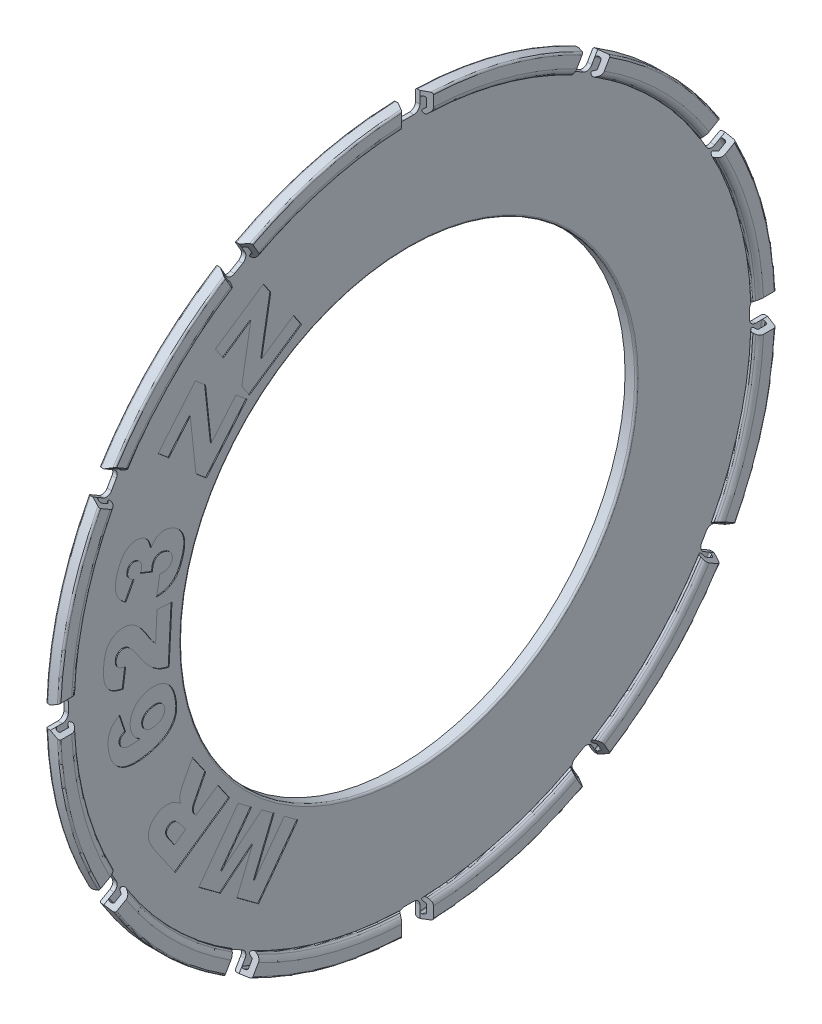
from build123d import *
from OCP.BRepFilletAPI import BRepFilletAPI_MakeFillet

# Parameters (mm, degrees)
FILLET1_R1         = 0.02
FILLET1_R2         = 0.08
SKETCH3_W          = 0.249361734
SKETCH3_H          = 0.345695775
CUT_EXTRUDE2_DEPTH = 6.799732894
CUT_EXTRUDE2_TAPER = -30
CUT_EXTRUDE3_REACH = 7.8
CIRPATTERN2_COUNT  = 12
CUT_EXTRUDE1_DEPTH = 0.01


with BuildPart() as part:
    # Sketch1 → Revolve1 (revolve)
    with BuildSketch(Plane.XY):
        Polygon((1.02, -2.65), (1.1, -2.65), (1.1, -4.1), (1.248703916, -4.1), (1.248703916, -3.92), (1.187420361, -3.868576991), (1.15528098, -3.906879213), (1.198703916, -3.943315383), (1.198703916, -4.05), (1.15, -4.05), (1.15, -2.6), (1.02, -2.6), align=None)
    revolve(axis=Axis((-6.429017492, 0, 0), (1, 0, 0)))

    # Fillet1: one fillet with a radius per group of edges: ONE call of the kernel's fillet builder (fillet() takes one radius for all edges)
    fillet1_edges_1 = [part.edges().sort_by_distance(p)[0] for p in [
        (1.187420361, 3.868576991, 0),
        (1.15528098, 3.906879213, 0),
        (1.15, 2.6, 0),
        (1.248703916, 4.1, 0),
        (1.1, 4.1, 0),
        (1.15, 4.05, 0),
        (1.198703916, 4.05, 0),
    ]]
    fillet1_edges_2 = [part.edges().sort_by_distance(p)[0] for p in [
        (1.248703916, 3.92, 0),
    ]]
    fillet1 = BRepFilletAPI_MakeFillet(part.part.solid().wrapped)
    for e in fillet1_edges_1:
        fillet1.Add(FILLET1_R1, e.wrapped)
    for e in fillet1_edges_2:
        fillet1.Add(FILLET1_R2, e.wrapped)
    add(Compound.cast(fillet1.Shape()), mode=Mode.REPLACE)

    # Sketch3 → Cut-Extrude2 (cut, through all)
    with BuildSketch(Plane(origin=(1.15, 0, 0), x_dir=(0, 0, -1), z_dir=(1, 0, 0))):
        with Locations((0, 3.957248854)):
            Rectangle(SKETCH3_W, SKETCH3_H)
    cut_extrude2 = extrude(amount=CUT_EXTRUDE2_DEPTH, taper=CUT_EXTRUDE2_TAPER, mode=Mode.SUBTRACT)

    # Cut-Extrude3: up to this face of the body (flat: up to its plane)
    cut_extrude3_end = Plane(part.part.faces().sort_by_distance((1.1, 3.964600173, 0))[0])
    # Sketch4 → Cut-Extrude3 (cut, up to the picked face)
    with BuildSketch(Plane(origin=(1.15, 0, 0), x_dir=(0, 0, -1), z_dir=(1, 0, 0)), mode=Mode.PRIVATE) as cut_extrude3_sk1:
        with BuildLine():
            Line((-0.124680867, 4.098103791), (-0.124680867, 3.96268108))
            ThreePointArc((-0.124680867, 3.96268108), (-0.104178342, 3.913183605), (-0.054680867, 3.89268108))
            Line((-0.054680867, 3.89268108), (0.054680867, 3.89268108))
            ThreePointArc((0.054680867, 3.89268108), (0.104178342, 3.913183605), (0.124680867, 3.96268108))
            Line((0.124680867, 3.96268108), (0.124680867, 4.098103791))
            ThreePointArc((0.124680867, 4.098103791), (0, 4.1), (-0.124680867, 4.098103791))
        make_face()
    cut_extrude3_tool1 = split(extrude(cut_extrude3_sk1.sketch, amount=-CUT_EXTRUDE3_REACH, mode=Mode.PRIVATE), bisect_by=cut_extrude3_end, keep=Keep.BOTH, mode=Mode.PRIVATE)
    cut_extrude3 = cut_extrude3_tool1.solids().sort_by(Axis((1.15, 3.999757, 0), (-1, 0, 0)))[0]
    add(cut_extrude3, mode=Mode.SUBTRACT)

    # CirPattern2: Cut-Extrude2, Cut-Extrude3 ×12 about axis
    cirpattern2_axis = Axis((0, 0, 0), (1, 0, 0))
    add([cut_extrude2.rotate(cirpattern2_axis, i * 360 / CIRPATTERN2_COUNT) for i in range(1, CIRPATTERN2_COUNT)], mode=Mode.SUBTRACT)
    add([cut_extrude3.rotate(cirpattern2_axis, i * 360 / CIRPATTERN2_COUNT) for i in range(1, CIRPATTERN2_COUNT)], mode=Mode.SUBTRACT)

    # Sketch2 → Cut-Extrude1 (cut)
    # profile 1 of 7: a face of its own
    with BuildSketch(Plane(origin=(1.15, 0, 0), x_dir=(0, 0, -1), z_dir=(1, 0, 0))):
        Polygon((-2.212074833, 2.706157821), (-1.663424265, 3.076135499), (-1.57895795, 2.950729655), (-1.682904784, 2.346376977), (-1.31825381, 2.592318535), (-1.22739545, 2.457476814), (-1.822768826, 2.055995483), (-1.910583356, 2.186119266), (-1.807701862, 2.784079899), (-2.121825239, 2.572229249), align=None)
    # profile 2 of 7: a face of its own
    with BuildSketch(Plane(origin=(1.15, 0, 0), x_dir=(0, 0, -1), z_dir=(1, 0, 0))):
        Polygon((-2.866893351, 1.999189565), (-2.440756987, 2.505226496), (-2.325091403, 2.407823899), (-2.259649033, 1.798144516), (-1.976420542, 2.13448786), (-1.852080039, 2.029780068), (-2.314590185, 1.480672925), (-2.434669325, 1.581880311), (-2.499502929, 2.185015457), (-2.743465997, 1.89524273), align=None)
    # profile 3 of 7: a face of its own
    with BuildSketch(Plane(origin=(1.15, 0, 0), x_dir=(0, 0, -1), z_dir=(1, 0, 0))):
        with BuildLine():
            Line((-3.141397188, 0.890050122), (-3.234994996, 0.712290381))
            add(Edge.make_bspline(
                [(-3.234994996, 0.712290381), (-3.241652025, 0.716717018), (-3.254716815, 0.72540454), (-3.272940512, 0.739733467), (-3.289267173, 0.755137837), (-3.30379652, 0.771514362), (-3.316687436, 0.788790714), (-3.327785169, 0.807039293), (-3.337140333, 0.826251788), (-3.344830176, 0.846382003), (-3.35047259, 0.867753095), (-3.354119764, 0.890280058), (-3.355562981, 0.914076921), (-3.355057782, 0.939058583), (-3.352589821, 0.965358989), (-3.347977427, 0.992862404), (-3.341211907, 1.021605488), (-3.335394145, 1.040951868), (-3.332397593, 1.050916599)],
                knots=[0, 0, 0, 0, 0.996965878, 1.956601256, 2.88770829, 3.793173997, 4.684173077, 5.573012264, 6.45318163, 7.346402628, 8.25663212, 9.205419306, 10.188307953, 11.226283579, 12.319409183, 13.480414381, 14.702238262, 16, 16, 16, 16], degree=3))
            add(Edge.make_bspline(
                [(-3.332397593, 1.050916599), (-3.328675336, 1.062176722), (-3.321480778, 1.083940828), (-3.308895369, 1.114677512), (-3.295848569, 1.142701673), (-3.281461002, 1.167473761), (-3.266605518, 1.189563268), (-3.250552217, 1.208460808), (-3.233834011, 1.224700397), (-3.215990926, 1.237706128), (-3.197629089, 1.247986463), (-3.179187478, 1.256354815), (-3.160432751, 1.262318172), (-3.141460028, 1.266199054), (-3.122239136, 1.267729801), (-3.102852561, 1.266870021), (-3.083215593, 1.264078942), (-3.070339067, 1.26038676), (-3.063779493, 1.258505885)],
                knots=[0, 0, 0, 0, 1.486482005, 2.873143656, 4.16197067, 5.358788456, 6.461443456, 7.494932611, 8.462177862, 9.376883809, 10.254180828, 11.09697377, 11.911647764, 12.716227884, 13.52017922, 14.322241245, 15.145314161, 16, 16, 16, 16], degree=3))
            add(Edge.make_bspline(
                [(-3.063779493, 1.258505885), (-3.05627325, 1.255786904), (-3.041489309, 1.25043173), (-3.021159139, 1.238562115), (-3.002838189, 1.224060775), (-2.986931475, 1.206418047), (-2.973065732, 1.186063316), (-2.961590577, 1.162779945), (-2.952222287, 1.136674978), (-2.948014303, 1.118088437), (-2.945831035, 1.108445008)],
                knots=[0, 0, 0, 0, 0.951343852, 1.873721842, 2.795821485, 3.730286132, 4.69776014, 5.726874251, 6.820612936, 8, 8, 8, 8], degree=3))
            add(Edge.make_bspline(
                [(-2.945831035, 1.108445008), (-2.942066207, 1.114493909), (-2.934964492, 1.125904141), (-2.923542305, 1.141107076), (-2.912985264, 1.154144046), (-2.905277386, 1.161181261), (-2.901695483, 1.164451501)],
                knots=[0, 0, 0, 0, 1.193944278, 2.252174855, 3.187773934, 4, 4, 4, 4], degree=3))
            add(Edge.make_bspline(
                [(-2.901695483, 1.164451501), (-2.896016699, 1.168960545), (-2.884778888, 1.177883543), (-2.866219024, 1.188611368), (-2.846507989, 1.196530549), (-2.825832536, 1.202100475), (-2.8040212, 1.204879141), (-2.781249093, 1.204467835), (-2.757514572, 1.201111708), (-2.741798329, 1.196608404), (-2.733676003, 1.194281047)],
                knots=[0, 0, 0, 0, 0.972616807, 1.924722696, 2.865728001, 3.81734653, 4.792250057, 5.807182763, 6.866728094, 8, 8, 8, 8], degree=3))
            add(Edge.make_bspline(
                [(-2.733676003, 1.194281047), (-2.723405031, 1.19061102), (-2.702896462, 1.183282892), (-2.67424629, 1.167070072), (-2.647600099, 1.147128777), (-2.627326004, 1.127542297), (-2.612408075, 1.110339787), (-2.602292888, 1.09653717), (-2.593376442, 1.082090984), (-2.585363251, 1.067079644), (-2.578510688, 1.05141923), (-2.5728841, 1.035013445), (-2.568324391, 1.018036173), (-2.564945276, 1.00038764), (-2.562846997, 0.981975525), (-2.561862729, 0.962701691), (-2.562622397, 0.942521542), (-2.564420967, 0.921431427), (-2.567641424, 0.899431172), (-2.572266756, 0.876535574), (-2.578184953, 0.85276001), (-2.583083654, 0.83676179), (-2.585593616, 0.828564732)],
                knots=[0, 0, 0, 0, 1.468544657, 2.93231749, 4.418159492, 5.947000875, 6.72313198, 7.486618499, 8.251635851, 9.01057301, 9.779495404, 10.553996804, 11.347185151, 12.148152775, 12.974626404, 13.8443874, 14.747798274, 15.695402368, 16.697679072, 17.744132734, 18.844154151, 20, 20, 20, 20], degree=3))
            add(Edge.make_bspline(
                [(-2.585593616, 0.828564732), (-2.588176667, 0.820631812), (-2.593204973, 0.80518916), (-2.601455124, 0.782965659), (-2.609890597, 0.762261113), (-2.618852313, 0.743130154), (-2.627789962, 0.725318468), (-2.637477837, 0.709217365), (-2.647160583, 0.694500321), (-2.660472911, 0.677170892), (-2.678401335, 0.658069034), (-2.701752935, 0.638203945), (-2.727186872, 0.621922415), (-2.75449044, 0.608912505), (-2.783826529, 0.59908208), (-2.815273453, 0.592770731), (-2.848777556, 0.588711328), (-2.871853383, 0.588811461), (-2.883736879, 0.588863027)],
                knots=[0, 0, 0, 0, 0.957077744, 1.863099244, 2.719135602, 3.521173556, 4.286468441, 5.004158756, 5.675688924, 6.306645927, 7.509093788, 8.673877084, 9.815319901, 10.963391327, 12.135813007, 13.354935907, 14.637855525, 16, 16, 16, 16], degree=3))
            Line((-2.883736879, 0.588863027), (-2.846906522, 0.796604505))
            add(Edge.make_bspline(
                [(-2.846906522, 0.796604505), (-2.84173485, 0.796116766), (-2.831758425, 0.795175892), (-2.817291302, 0.794318742), (-2.803867737, 0.794469213), (-2.791479013, 0.795426964), (-2.780043887, 0.79680153), (-2.769659634, 0.799272541), (-2.760296903, 0.802418464), (-2.749308866, 0.807738941), (-2.737185159, 0.816209466), (-2.724837753, 0.828957383), (-2.715099371, 0.844505375), (-2.71079128, 0.856169694), (-2.708564395, 0.862199066)],
                knots=[0, 0, 0, 0, 1.106073005, 2.133672459, 3.084299769, 3.961649642, 4.778960599, 5.53354789, 6.230416036, 6.877808649, 8.127330516, 9.357275926, 10.633956453, 12, 12, 12, 12], degree=3))
            add(Edge.make_bspline(
                [(-2.708564395, 0.862199066), (-2.706839977, 0.868747377), (-2.703468701, 0.881549469), (-2.70363803, 0.901346703), (-2.707818281, 0.920554317), (-2.716324791, 0.938806489), (-2.72853607, 0.955642955), (-2.74453588, 0.970206792), (-2.764255971, 0.981837995), (-2.778977061, 0.987232435), (-2.786638665, 0.990039975)],
                knots=[0, 0, 0, 0, 0.965377401, 1.887334252, 2.801512917, 3.75979478, 4.747193907, 5.759497664, 6.833928598, 8, 8, 8, 8], degree=3))
            add(Edge.make_bspline(
                [(-2.786638665, 0.990039975), (-2.790731478, 0.99126852), (-2.798646977, 0.993644524), (-2.81050287, 0.996108477), (-2.821908646, 0.997515346), (-2.832910506, 0.997786997), (-2.843467131, 0.997249201), (-2.853574645, 0.995564832), (-2.863234135, 0.992825446), (-2.875300833, 0.98775514), (-2.889215679, 0.97924007), (-2.903214877, 0.965236291), (-2.914556792, 0.947872788), (-2.91941207, 0.934562951), (-2.92193696, 0.927641437)],
                knots=[0, 0, 0, 0, 0.910977311, 1.761829841, 2.57907118, 3.358334845, 4.106094558, 4.829993581, 5.53886079, 6.242091453, 7.617117862, 8.986514487, 10.432897026, 12, 12, 12, 12], degree=3))
            add(Edge.make_bspline(
                [(-2.92193696, 0.927641437), (-2.923067095, 0.923293036), (-2.925529919, 0.913816872), (-2.928047247, 0.897987823), (-2.929577634, 0.879472098), (-2.930153434, 0.866209351), (-2.930459688, 0.859155235)],
                knots=[0, 0, 0, 0, 0.778957448, 1.697527352, 2.775373591, 4, 4, 4, 4], degree=3))
            Line((-2.930459688, 0.859155235), (-3.069867155, 0.914857346))
            add(Edge.make_bspline(
                [(-3.069867155, 0.914857346), (-3.067588218, 0.919585481), (-3.063613972, 0.927830894), (-3.060529501, 0.936446116), (-3.059213746, 0.940121144)],
                knots=[0, 0, 0, 0, 1.146852366, 2, 2, 2, 2], degree=3))
            add(Edge.make_bspline(
                [(-3.059213746, 0.940121144), (-3.057488932, 0.946467761), (-3.054121916, 0.958857017), (-3.053433036, 0.977878384), (-3.056333937, 0.99625753), (-3.062971575, 1.013482869), (-3.072239925, 1.029050803), (-3.08396119, 1.042183531), (-3.098169841, 1.052296388), (-3.1089674, 1.056324962), (-3.114459282, 1.058373985)],
                knots=[0, 0, 0, 0, 1.08461134, 2.117274327, 3.119891392, 4.141971817, 5.150467332, 6.100726669, 7.033986697, 8, 8, 8, 8], degree=3))
            add(Edge.make_bspline(
                [(-3.114459282, 1.058373985), (-3.119745281, 1.059848661), (-3.12988587, 1.06267766), (-3.145293758, 1.063477981), (-3.15978419, 1.061121702), (-3.173328131, 1.056004686), (-3.185295152, 1.047702639), (-3.195766217, 1.037026145), (-3.204053729, 1.023444716), (-3.207782149, 1.013201222), (-3.209731197, 1.007846388)],
                knots=[0, 0, 0, 0, 1.078489428, 2.068959391, 3.010225977, 3.952870467, 4.89514418, 5.856145084, 6.879289992, 8, 8, 8, 8], degree=3))
            add(Edge.make_bspline(
                [(-3.209731197, 1.007846388), (-3.211275304, 1.002153641), (-3.214259155, 0.991152905), (-3.214935751, 0.974388971), (-3.212741472, 0.958363596), (-3.206938511, 0.943012855), (-3.197096815, 0.928370056), (-3.182518323, 0.914860399), (-3.163823026, 0.90155429), (-3.149224101, 0.894065228), (-3.141397188, 0.890050122)],
                knots=[0, 0, 0, 0, 0.931616347, 1.800267452, 2.6365463, 3.478172771, 4.376201162, 5.404643436, 6.608553058, 8, 8, 8, 8], degree=3))
        make_face()
    # profile 4 of 7: a face of its own
    with BuildSketch(Plane(origin=(1.15, 0, 0), x_dir=(0, 0, -1), z_dir=(1, 0, 0))):
        with BuildLine():
            Line((-2.708015014, 0.451318248), (-2.74088839, -0.176471931))
            add(Edge.make_bspline(
                [(-2.74088839, -0.176471931), (-2.748572037, -0.175055613), (-2.763846211, -0.172240142), (-2.786375266, -0.166130244), (-2.808523188, -0.15893608), (-2.830235826, -0.150141865), (-2.851536635, -0.140191181), (-2.872283803, -0.128566516), (-2.892882866, -0.116095913), (-2.913092173, -0.10166559), (-2.933515243, -0.085095951), (-2.954474013, -0.065749172), (-2.976067704, -0.043250745), (-2.998412162, -0.017730441), (-3.021653279, 0.010661705), (-3.045565624, 0.042201611), (-3.070380175, 0.076643351), (-3.086643344, 0.101021529), (-3.095038147, 0.113605179)],
                knots=[0, 0, 0, 0, 0.793429032, 1.577242224, 2.369314293, 3.15790796, 3.95559384, 4.756022087, 5.572759965, 6.400737883, 7.276468852, 8.243030276, 9.296379999, 10.442997531, 11.68822691, 13.023092273, 14.463364906, 16, 16, 16, 16], degree=3))
            add(Edge.make_bspline(
                [(-3.095038147, 0.113605179), (-3.100138657, 0.121230345), (-3.109918298, 0.135850721), (-3.124342923, 0.156616675), (-3.138057591, 0.175103412), (-3.150645785, 0.191620908), (-3.162362744, 0.205941848), (-3.173127556, 0.218225002), (-3.183131792, 0.228248471), (-3.194859699, 0.238647252), (-3.208873113, 0.248750628), (-3.225586738, 0.257920208), (-3.242111011, 0.264091761), (-3.253272602, 0.265345549), (-3.258644072, 0.265948929)],
                knots=[0, 0, 0, 0, 1.430961346, 2.74370368, 3.943369243, 5.021209643, 5.98274246, 6.829149717, 7.567744642, 8.190069628, 9.272779028, 10.253558271, 11.159531995, 12, 12, 12, 12], degree=3))
            add(Edge.make_bspline(
                [(-3.258644072, 0.265948929), (-3.264197304, 0.265929377), (-3.275157005, 0.265890789), (-3.291099353, 0.261751401), (-3.305941623, 0.254424623), (-3.319135992, 0.243863735), (-3.330639044, 0.231090828), (-3.33910425, 0.215945862), (-3.344759222, 0.199047624), (-3.345980891, 0.18705654), (-3.346610793, 0.180873848)],
                knots=[0, 0, 0, 0, 0.975318568, 1.924860908, 2.872255198, 3.871807218, 4.885053729, 5.881764118, 6.907821917, 8, 8, 8, 8], degree=3))
            add(Edge.make_bspline(
                [(-3.346610793, 0.180873848), (-3.346651482, 0.174464181), (-3.346730155, 0.162070797), (-3.34282415, 0.144119191), (-3.335551895, 0.127959501), (-3.326976319, 0.115863971), (-3.318215593, 0.107344633), (-3.310348999, 0.101321201), (-3.301169733, 0.095810297), (-3.290912101, 0.090672455), (-3.279341455, 0.086084569), (-3.266537306, 0.082085076), (-3.252568629, 0.078173887), (-3.242730943, 0.076248805), (-3.237641637, 0.075252907)],
                knots=[0, 0, 0, 0, 1.361875955, 2.633249472, 3.87602828, 5.114291299, 5.763646398, 6.472382254, 7.219047427, 8.040367039, 8.913013902, 9.866199743, 10.896126464, 12, 12, 12, 12], degree=3))
            Line((-3.237641637, 0.075252907), (-3.265644884, -0.13340172))
            add(Edge.make_bspline(
                [(-3.265644884, -0.13340172), (-3.272761562, -0.131943187), (-3.286653459, -0.129096103), (-3.306689343, -0.123883056), (-3.325544571, -0.118258288), (-3.343151843, -0.112089854), (-3.35950984, -0.1052148), (-3.374629411, -0.097781806), (-3.388474798, -0.089690244), (-3.4053537, -0.078422311), (-3.424141717, -0.062030692), (-3.443778963, -0.039309812), (-3.459799071, -0.01305803), (-3.470985488, 0.010922544), (-3.477903156, 0.0320308), (-3.482573966, 0.04942467), (-3.485872104, 0.068288875), (-3.488755355, 0.088473711), (-3.490253942, 0.110085069), (-3.49121661, 0.133074658), (-3.491207599, 0.15744693), (-3.490494069, 0.174128546), (-3.490127433, 0.182700147)],
                knots=[0, 0, 0, 0, 0.997034666, 1.946231286, 2.840666683, 3.697414948, 4.505731738, 5.274948675, 6.008278083, 6.705507205, 8.058273482, 9.416316791, 10.811400837, 12.266591674, 13.037320093, 13.858197364, 14.736410977, 15.664112006, 16.655904539, 17.708236726, 18.822411473, 20, 20, 20, 20], degree=3))
            add(Edge.make_bspline(
                [(-3.490127433, 0.182700147), (-3.489587271, 0.191634285), (-3.488536162, 0.209019392), (-3.485866374, 0.23428408), (-3.482791294, 0.258015602), (-3.478771372, 0.280134581), (-3.474308868, 0.300687916), (-3.468982828, 0.319649175), (-3.462891862, 0.337017432), (-3.456178095, 0.353001779), (-3.44867817, 0.367772681), (-3.440228115, 0.381488589), (-3.431139547, 0.394449935), (-3.421216585, 0.406506289), (-3.410539876, 0.417656813), (-3.39903043, 0.427921986), (-3.386729999, 0.43735181), (-3.373620496, 0.445837936), (-3.360033876, 0.453451962), (-3.345954173, 0.459833456), (-3.33157377, 0.465207971), (-3.316877888, 0.469472842), (-3.301804303, 0.472509664), (-3.286450319, 0.474517147), (-3.270721879, 0.475274092), (-3.260165565, 0.474929576), (-3.254839283, 0.474755748)],
                knots=[0, 0, 0, 0, 1.517404861, 2.952746514, 4.306707147, 5.573838247, 6.763387418, 7.871665646, 8.910864369, 9.882203375, 10.809307837, 11.716567676, 12.611511199, 13.49148966, 14.36144762, 15.226501486, 16.103911768, 16.986660499, 17.872254385, 18.74216982, 19.604954155, 20.473379898, 21.333716735, 22.209650071, 23.096663112, 24, 24, 24, 24], degree=3))
            add(Edge.make_bspline(
                [(-3.254839283, 0.474755748), (-3.249148243, 0.474333172), (-3.237765937, 0.473488004), (-3.22092676, 0.470706339), (-3.204284641, 0.466720062), (-3.187952833, 0.461419874), (-3.171859955, 0.45478861), (-3.156034606, 0.447035674), (-3.140444687, 0.43803086), (-3.125067638, 0.427572143), (-3.109728457, 0.415341768), (-3.094009646, 0.401385698), (-3.078267179, 0.385117547), (-3.062061896, 0.367028492), (-3.045840551, 0.346621978), (-3.029070468, 0.324326427), (-3.012238998, 0.299772165), (-3.001191797, 0.282567432), (-2.995504868, 0.273710699)],
                knots=[0, 0, 0, 0, 0.800215034, 1.600461711, 2.390998423, 3.198929055, 4.006389423, 4.830702468, 5.669268767, 6.529861257, 7.436785155, 8.419605114, 9.476394529, 10.610505815, 11.825276582, 13.131860768, 14.523525948, 16, 16, 16, 16], degree=3))
            add(Edge.make_bspline(
                [(-2.995504868, 0.273710699), (-2.992266052, 0.268480482), (-2.986063045, 0.258463527), (-2.977022282, 0.244145385), (-2.96891367, 0.231088582), (-2.961358433, 0.219482801), (-2.954718393, 0.209147871), (-2.948783889, 0.200166918), (-2.943618491, 0.192550142), (-2.937597291, 0.183989034), (-2.929755044, 0.173856028), (-2.919602367, 0.161275923), (-2.90813421, 0.147721291), (-2.900040965, 0.138402899), (-2.895819397, 0.133542274)],
                knots=[0, 0, 0, 0, 1.285272736, 2.461565029, 3.537867242, 4.496295874, 5.354745273, 6.104353983, 6.745217981, 7.277492065, 8.290787016, 9.421352561, 10.654935392, 12, 12, 12, 12], degree=3))
            Line((-2.895819397, 0.133542274), (-2.878621751, 0.46029755))
            Line((-2.878621751, 0.46029755), (-2.708015014, 0.451318248))
        make_face()
    # profile 5 of 7: a face of its own
    with BuildSketch(Plane(origin=(1.15, 0, 0), x_dir=(0, 0, -1), z_dir=(1, 0, 0))):
        with BuildLine():
            Line((-3.305913474, -0.369455799), (-3.238796997, -0.568522357))
            add(Edge.make_bspline(
                [(-3.238796997, -0.568522357), (-3.245158881, -0.571267245), (-3.257085118, -0.576412919), (-3.272784073, -0.585815616), (-3.285149072, -0.596044088), (-3.294129854, -0.607200114), (-3.299873898, -0.619131335), (-3.303149461, -0.631577539), (-3.303961762, -0.644734426), (-3.302535772, -0.653509673), (-3.301804302, -0.658010994)],
                knots=[0, 0, 0, 0, 1.376229227, 2.579932909, 3.62451481, 4.550563211, 5.402963822, 6.237033689, 7.095674723, 8, 8, 8, 8], degree=3))
            add(Edge.make_bspline(
                [(-3.301804302, -0.658010994), (-3.300861106, -0.662055866), (-3.299013407, -0.669979673), (-3.294197879, -0.681073089), (-3.287848735, -0.691059872), (-3.280206866, -0.700117759), (-3.271117117, -0.708099367), (-3.260583748, -0.714974865), (-3.248663666, -0.720994043), (-3.239956949, -0.723917925), (-3.235448782, -0.725431854)],
                knots=[0, 0, 0, 0, 0.997858564, 1.954780912, 2.892909725, 3.836976372, 4.797008143, 5.792399625, 6.856947905, 8, 8, 8, 8], degree=3))
            add(Edge.make_bspline(
                [(-3.235448782, -0.725431854), (-3.231660809, -0.726430469), (-3.223364981, -0.728617481), (-3.209356978, -0.730188049), (-3.192957606, -0.731275858), (-3.174004935, -0.731345294), (-3.152540391, -0.730497149), (-3.128531202, -0.72899482), (-3.102041606, -0.726535187), (-3.083607172, -0.724311208), (-3.073973539, -0.723148981)],
                knots=[0, 0, 0, 0, 0.578532959, 1.267012559, 2.078796009, 3.008922317, 4.067196305, 5.25469, 6.565330996, 8, 8, 8, 8], degree=3))
            add(Edge.make_bspline(
                [(-3.073973539, -0.723148981), (-3.081166869, -0.718301075), (-3.095145518, -0.70888024), (-3.114074814, -0.693057801), (-3.130791115, -0.676658582), (-3.145190242, -0.659211429), (-3.157500677, -0.64041503), (-3.167208463, -0.619607941), (-3.175729431, -0.597152384), (-3.179286585, -0.581161614), (-3.181116396, -0.572935913)],
                knots=[0, 0, 0, 0, 1.094092579, 2.126127191, 3.108513383, 4.045476207, 4.976008096, 5.935278565, 6.937900982, 8, 8, 8, 8], degree=3))
            add(Edge.make_bspline(
                [(-3.181116396, -0.572935913), (-3.18262125, -0.564791868), (-3.18557718, -0.548794818), (-3.186768865, -0.524697552), (-3.185985057, -0.501138799), (-3.18252543, -0.478056125), (-3.177002918, -0.455389269), (-3.168578553, -0.433395427), (-3.158110148, -0.411820902), (-3.14512331, -0.391117323), (-3.130422608, -0.371411625), (-3.113693748, -0.353496578), (-3.095350834, -0.337489166), (-3.075487364, -0.323208479), (-3.053926355, -0.311030064), (-3.030759591, -0.300828071), (-3.006019058, -0.292358953), (-2.98873755, -0.288386346), (-2.979919156, -0.286359208)],
                knots=[0, 0, 0, 0, 1.015217046, 1.994153795, 2.953538227, 3.903444368, 4.853105709, 5.810468424, 6.787661882, 7.791304586, 8.804745155, 9.800168768, 10.792765989, 11.787780759, 12.796948867, 13.825306894, 14.890299314, 16, 16, 16, 16], degree=3))
            add(Edge.make_bspline(
                [(-2.979919156, -0.286359208), (-2.973895744, -0.285205508), (-2.961905284, -0.282908903), (-2.943836097, -0.281055777), (-2.925955023, -0.28005676), (-2.90825332, -0.28036094), (-2.890726623, -0.281942172), (-2.87336561, -0.284443963), (-2.856220703, -0.288378087), (-2.839238376, -0.293123221), (-2.822789991, -0.299213515), (-2.806961422, -0.306249301), (-2.791892595, -0.314313801), (-2.777544317, -0.323407089), (-2.764141221, -0.333748572), (-2.75127717, -0.344819769), (-2.73924124, -0.357054923), (-2.727949923, -0.370331293), (-2.717451299, -0.384690674), (-2.707594152, -0.400147895), (-2.698765706, -0.416935897), (-2.690267754, -0.434652693), (-2.683040516, -0.453760676), (-2.676360756, -0.473909679), (-2.670377509, -0.495284795), (-2.667143765, -0.510012608), (-2.665491396, -0.517538185)],
                knots=[0, 0, 0, 0, 1.000929695, 1.992493116, 2.962899351, 3.923891704, 4.880052671, 5.834777421, 6.78532487, 7.750164913, 8.711906634, 9.646292579, 10.576446766, 11.50016126, 12.416305573, 13.338124046, 14.269420861, 15.215482523, 16.181353131, 17.171774177, 18.205713531, 19.276585623, 20.377969038, 21.538354381, 22.742155216, 24, 24, 24, 24], degree=3))
            add(Edge.make_bspline(
                [(-2.665491396, -0.517538185), (-2.663781419, -0.526553985), (-2.660440072, -0.544171136), (-2.656996463, -0.570232613), (-2.654707569, -0.59516111), (-2.65431954, -0.619007379), (-2.655181539, -0.641675317), (-2.657408891, -0.66325413), (-2.661201774, -0.683721199), (-2.66654018, -0.703174617), (-2.673458012, -0.721744652), (-2.681907276, -0.739633771), (-2.691778694, -0.757052681), (-2.703452192, -0.773860305), (-2.716712298, -0.790061687), (-2.731360569, -0.805872325), (-2.74777625, -0.820928205), (-2.765699421, -0.835554674), (-2.785417917, -0.849487828), (-2.807046331, -0.862394616), (-2.830691922, -0.874277843), (-2.856205813, -0.885335655), (-2.883650775, -0.89550739), (-2.913002479, -0.904809037), (-2.944293482, -0.913159626), (-2.965947183, -0.917841371), (-2.977027516, -0.920237049)],
                knots=[0, 0, 0, 0, 1.129677814, 2.207425309, 3.235555562, 4.210169223, 5.141632426, 6.027340175, 6.878796051, 7.701658798, 8.508045382, 9.315592375, 10.135295873, 10.970442589, 11.831852822, 12.7113495, 13.621906363, 14.572093796, 15.558189464, 16.59193987, 17.670230266, 18.81440745, 20.014116808, 21.272492673, 22.604317472, 24, 24, 24, 24], degree=3))
            add(Edge.make_bspline(
                [(-2.977027516, -0.920237049), (-2.993225349, -0.923353002), (-3.024518553, -0.92937283), (-3.070463056, -0.934458095), (-3.113521916, -0.936566175), (-3.153864771, -0.935562202), (-3.191466931, -0.930817803), (-3.226363041, -0.923042323), (-3.258453827, -0.911797815), (-3.28763365, -0.897028833), (-3.314056059, -0.879265382), (-3.33798879, -0.85887286), (-3.359422064, -0.835885591), (-3.378415274, -0.810265617), (-3.394893139, -0.781986652), (-3.408671897, -0.751017833), (-3.420281649, -0.717544214), (-3.425564553, -0.693991301), (-3.428275487, -0.681905068)],
                knots=[0, 0, 0, 0, 1.358393524, 2.624331739, 3.804117078, 4.907931701, 5.944145187, 6.921470006, 7.848055704, 8.737704696, 9.608192535, 10.464928045, 11.322427703, 12.191710852, 13.086966777, 14.012873644, 14.980301475, 16, 16, 16, 16], degree=3))
            add(Edge.make_bspline(
                [(-3.428275487, -0.681905068), (-3.429697015, -0.674761595), (-3.432471369, -0.660819887), (-3.435657583, -0.640306478), (-3.437915952, -0.620806096), (-3.43952018, -0.602335538), (-3.440134415, -0.584862105), (-3.439877941, -0.568397049), (-3.438639727, -0.553004545), (-3.436086287, -0.534029127), (-3.430598637, -0.511687136), (-3.421595936, -0.4862622), (-3.409405393, -0.462640803), (-3.394492262, -0.440670621), (-3.376735084, -0.420239964), (-3.355752943, -0.401759484), (-3.332258618, -0.384288873), (-3.314860229, -0.374493079), (-3.305913474, -0.369455799)],
                knots=[0, 0, 0, 0, 0.954893233, 1.863637011, 2.720847669, 3.528416024, 4.293794443, 5.012273361, 5.686173113, 6.317359579, 7.520884693, 8.694934894, 9.846172531, 10.995506325, 12.169349251, 13.38458066, 14.655075761, 16, 16, 16, 16], degree=3))
        make_face()
        with BuildLine():
            add(Edge.make_bspline(
                [(-2.899105438, -0.68007877), (-2.894268508, -0.678979181), (-2.884814561, -0.676829997), (-2.871280405, -0.67255974), (-2.858738637, -0.667567996), (-2.847252797, -0.661724409), (-2.836653653, -0.655243963), (-2.827260848, -0.647724951), (-2.818715781, -0.639594715), (-2.811358824, -0.630640025), (-2.804976692, -0.621271425), (-2.799730336, -0.61157549), (-2.795651882, -0.60166952), (-2.792478206, -0.591617094), (-2.790874945, -0.581258323), (-2.790278607, -0.570763137), (-2.790650496, -0.560031019), (-2.791925723, -0.552937525), (-2.792571347, -0.549346221)],
                knots=[0, 0, 0, 0, 1.259530025, 2.461795273, 3.600798142, 4.684213274, 5.731864284, 6.750179252, 7.734414963, 8.722691344, 9.687674891, 10.610167385, 11.517139442, 12.405801891, 13.280717912, 14.171340133, 15.074183522, 16, 16, 16, 16], degree=3))
            add(Edge.make_bspline(
                [(-2.792571347, -0.549346221), (-2.794269161, -0.542899664), (-2.797575238, -0.530346568), (-2.807285412, -0.513379371), (-2.820469976, -0.498964866), (-2.83424752, -0.489477614), (-2.846627188, -0.483149417), (-2.857014229, -0.479640066), (-2.868026386, -0.476753747), (-2.879892605, -0.475392501), (-2.892509591, -0.474675609), (-2.905884921, -0.475449367), (-2.920028348, -0.476903623), (-2.929605085, -0.478707852), (-2.934566071, -0.479642487)],
                knots=[0, 0, 0, 0, 1.343558235, 2.616251763, 3.909012857, 5.264041033, 5.975290217, 6.715196572, 7.47670033, 8.273405669, 9.126028439, 10.029898385, 10.979438714, 12, 12, 12, 12], degree=3))
            add(Edge.make_bspline(
                [(-2.934566071, -0.479642487), (-2.939606807, -0.48073494), (-2.949369562, -0.482850772), (-2.963351295, -0.487170893), (-2.976165989, -0.492206477), (-2.988086264, -0.497548252), (-2.998586266, -0.504123303), (-3.008275231, -0.510994785), (-3.016660006, -0.518861743), (-3.026281676, -0.529832896), (-3.035600285, -0.544705425), (-3.042777143, -0.563846493), (-3.045164103, -0.58407545), (-3.043280111, -0.597453398), (-3.042317695, -0.604287374)],
                knots=[0, 0, 0, 0, 1.003348138, 1.943256238, 2.843388854, 3.682501785, 4.479930272, 5.250003065, 5.990462638, 6.711112567, 8.086111475, 9.3790688, 10.661126397, 12, 12, 12, 12], degree=3))
            add(Edge.make_bspline(
                [(-3.042317695, -0.604287374), (-3.040536397, -0.61114658), (-3.037070649, -0.624492064), (-3.026839927, -0.642504133), (-3.013268945, -0.658018916), (-2.998998587, -0.668323454), (-2.986172997, -0.674995326), (-2.975632527, -0.678920909), (-2.964463612, -0.681819137), (-2.952635578, -0.683640407), (-2.940154968, -0.684370902), (-2.927027069, -0.684033508), (-2.913238696, -0.682664498), (-2.903914516, -0.680958607), (-2.899105438, -0.68007877)],
                knots=[0, 0, 0, 0, 1.395403329, 2.714939882, 4.050491595, 5.442216064, 6.164169728, 6.903459352, 7.659754088, 8.441087839, 9.264760513, 10.127244031, 11.034099634, 12, 12, 12, 12], degree=3))
        make_face(mode=Mode.SUBTRACT)
    # profile 6 of 7: a face of its own
    with BuildSketch(Plane(origin=(1.15, 0, 0), x_dir=(0, 0, -1), z_dir=(1, 0, 0))):
        with BuildLine():
            Line((-2.050248007, -1.816531337), (-2.670732991, -2.246168107))
            Line((-2.670732991, -2.246168107), (-2.892019517, -1.926565834))
            add(Edge.make_bspline(
                [(-2.892019517, -1.926565834), (-2.896987225, -1.919342301), (-2.906596392, -1.905369631), (-2.919813747, -1.884532432), (-2.931948373, -1.864862279), (-2.942351701, -1.845916374), (-2.951744257, -1.828205315), (-2.959538086, -1.811379257), (-2.965977824, -1.795543985), (-2.972671711, -1.775895453), (-2.978038819, -1.751716691), (-2.979450796, -1.722585111), (-2.975804842, -1.693550606), (-2.968923415, -1.669782268), (-2.961195869, -1.651150876), (-2.953919406, -1.637591301), (-2.945777926, -1.624372689), (-2.936046258, -1.611958344), (-2.925397212, -1.59983387), (-2.913452797, -1.588342672), (-2.900543142, -1.577060815), (-2.891068213, -1.57035631), (-2.886236237, -1.566937181)],
                knots=[0, 0, 0, 0, 1.273265003, 2.462909801, 3.583842418, 4.629491187, 5.601763304, 6.495196087, 7.321669269, 8.083639893, 9.50870878, 10.902963391, 12.298599811, 13.739921521, 14.483024362, 15.224664401, 15.972937096, 16.73490772, 17.512676547, 18.315150214, 19.140768888, 20, 20, 20, 20], degree=3))
            add(Edge.make_bspline(
                [(-2.886236237, -1.566937181), (-2.877731611, -1.561455938), (-2.861188457, -1.550793851), (-2.835048332, -1.538626515), (-2.808625565, -1.53075108), (-2.782180182, -1.526752837), (-2.755826849, -1.526550648), (-2.729802743, -1.529411425), (-2.704031062, -1.535648434), (-2.687601809, -1.542368665), (-2.679255718, -1.545782555)],
                knots=[0, 0, 0, 0, 1.112083918, 2.163219785, 3.158980477, 4.135207895, 5.095078329, 6.049629888, 7.009208306, 8, 8, 8, 8], degree=3))
            add(Edge.make_bspline(
                [(-2.679255718, -1.545782555), (-2.673708009, -1.548450434), (-2.661939094, -1.554110076), (-2.644749776, -1.56570318), (-2.626322738, -1.579519617), (-2.614337003, -1.590321684), (-2.608030069, -1.596005769)],
                knots=[0, 0, 0, 0, 0.843158393, 1.788676853, 2.836394241, 4, 4, 4, 4], degree=3))
            add(Edge.make_bspline(
                [(-2.608030069, -1.596005769), (-2.609872206, -1.589376643), (-2.613326455, -1.576946162), (-2.617171451, -1.559334858), (-2.619512791, -1.544020526), (-2.619779183, -1.53457753), (-2.61990101, -1.530259016)],
                knots=[0, 0, 0, 0, 1.231764342, 2.309719633, 3.226993273, 4, 4, 4, 4], degree=3))
            add(Edge.make_bspline(
                [(-2.61990101, -1.530259016), (-2.619718191, -1.527155132), (-2.61929518, -1.519973322), (-2.616649115, -1.508050681), (-2.613445424, -1.493319534), (-2.608683385, -1.47691537), (-2.603509303, -1.460422342), (-2.598385214, -1.44568407), (-2.593614359, -1.433540849), (-2.590113969, -1.426546505), (-2.588549549, -1.423420542)],
                knots=[0, 0, 0, 0, 0.666210599, 1.541487568, 2.613533809, 3.902381679, 5.203671867, 6.322497485, 7.250278455, 8, 8, 8, 8], degree=3))
            Line((-2.588549549, -1.423420542), (-2.472883965, -1.206243188))
            Line((-2.472883965, -1.206243188), (-2.322823088, -1.422963967))
            Line((-2.322823088, -1.422963967), (-2.441532504, -1.656730201))
            add(Edge.make_bspline(
                [(-2.441532504, -1.656730201), (-2.445055678, -1.663677248), (-2.451568475, -1.676519275), (-2.458772056, -1.694933914), (-2.463907665, -1.710496083), (-2.464854503, -1.720166857), (-2.465274387, -1.724455444)],
                knots=[0, 0, 0, 0, 1.292876629, 2.389958969, 3.286013647, 4, 4, 4, 4], degree=3))
            add(Edge.make_bspline(
                [(-2.465274387, -1.724455444), (-2.465089001, -1.729498647), (-2.464721467, -1.739496989), (-2.461158777, -1.754163866), (-2.455595845, -1.76834971), (-2.450103568, -1.776989619), (-2.447315783, -1.781375087)],
                knots=[0, 0, 0, 0, 0.997112696, 1.976813703, 2.973065575, 4, 4, 4, 4], degree=3))
            Line((-2.447315783, -1.781375087), (-2.435444841, -1.798420542))
            Line((-2.435444841, -1.798420542), (-2.183567812, -1.624009016))
            Line((-2.183567812, -1.624009016), (-2.050248007, -1.816531337))
        make_face()
        with BuildLine():
            Line((-2.552632341, -1.879538642), (-2.608791026, -1.798572733))
            add(Edge.make_bspline(
                [(-2.608791026, -1.798572733), (-2.610779586, -1.795951343), (-2.615525468, -1.789695153), (-2.625020091, -1.779795213), (-2.637496973, -1.76746023), (-2.647059594, -1.758664785), (-2.652317812, -1.753828415)],
                knots=[0, 0, 0, 0, 0.631189412, 1.506391623, 2.628834231, 4, 4, 4, 4], degree=3))
            add(Edge.make_bspline(
                [(-2.652317812, -1.753828415), (-2.65522175, -1.751271162), (-2.660910732, -1.746261354), (-2.670989978, -1.740853755), (-2.681863761, -1.737309677), (-2.693414777, -1.735899222), (-2.705140925, -1.736118799), (-2.716593077, -1.738470793), (-2.72767649, -1.74256171), (-2.734315118, -1.74679935), (-2.737697276, -1.748958285)],
                knots=[0, 0, 0, 0, 0.999700181, 1.958470803, 2.939418126, 3.946950437, 4.959357726, 5.964658511, 6.963061783, 8, 8, 8, 8], degree=3))
            add(Edge.make_bspline(
                [(-2.737697276, -1.748958285), (-2.742328951, -1.752425598), (-2.751159537, -1.759036253), (-2.761329818, -1.771567125), (-2.768073752, -1.78525007), (-2.770837065, -1.797618955), (-2.77112368, -1.80810669), (-2.769695352, -1.81671409), (-2.767479083, -1.826086874), (-2.763678841, -1.836039865), (-2.758982785, -1.846826425), (-2.752800875, -1.858115089), (-2.745661233, -1.870276059), (-2.740133819, -1.878354248), (-2.737240702, -1.882582473)],
                knots=[0, 0, 0, 0, 1.353485242, 2.580507166, 3.746417295, 4.904584073, 5.523699303, 6.197083379, 6.944850549, 7.780837285, 8.692163186, 9.703991385, 10.798240509, 12, 12, 12, 12], degree=3))
            Line((-2.737240702, -1.882582473), (-2.678799143, -1.966896597))
            Line((-2.678799143, -1.966896597), (-2.552632341, -1.879538642))
        make_face(mode=Mode.SUBTRACT)
    # profile 7 of 7: a face of its own
    with BuildSketch(Plane(origin=(1.15, 0, 0), x_dir=(0, 0, -1), z_dir=(1, 0, 0))):
        Polygon((-1.718982376, -3.031663129), (-1.965684892, -2.84918545), (-1.787620768, -2.409656229), (-2.155619957, -2.70856045), (-2.401257132, -2.526843729), (-1.952292035, -1.920208177), (-1.799339518, -2.033286505), (-2.141770525, -2.495948843), (-1.680477911, -2.121253226), (-1.541831402, -2.223982528), (-1.766009567, -2.774155012), (-1.423578561, -2.311492674), (-1.270017278, -2.425027577), align=None)
    extrude(amount=-CUT_EXTRUDE1_DEPTH, mode=Mode.SUBTRACT)


solid = part.part
